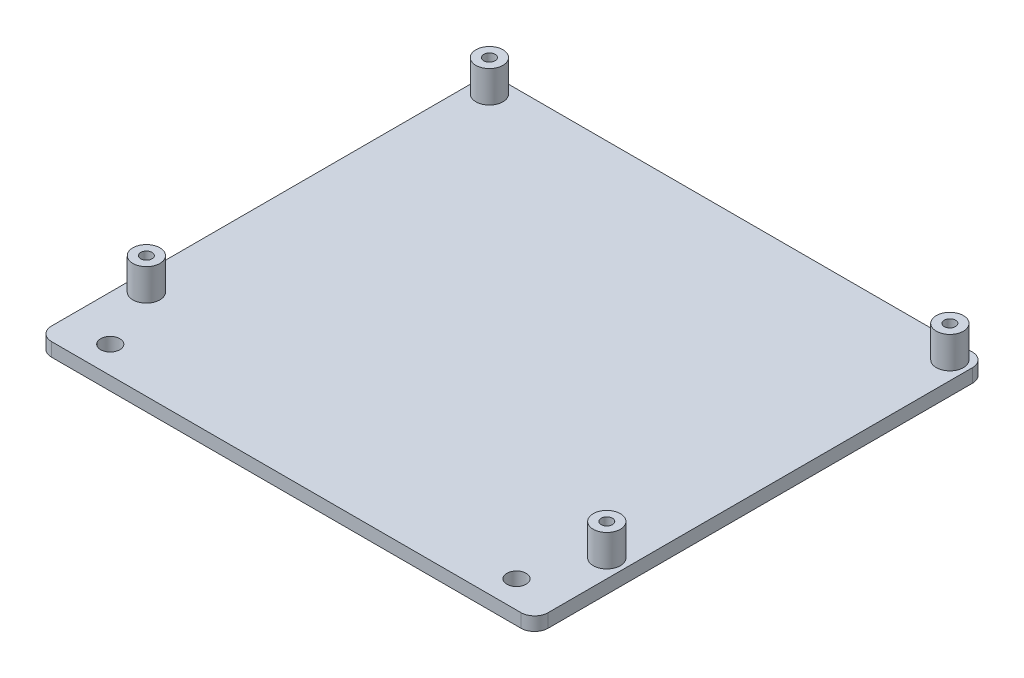
from build123d import *

# Parameters (mm, degrees)
SKETCH1_R           = 1.25
BOSS_EXTRUDE1_DEPTH = 3
FILLET1_R           = 3
SKETCH2_R           = 3
SKETCH2_R_2         = 1.25
BOSS_EXTRUDE2_DEPTH = 7
SKETCH4_R           = 2.125
CUT_EXTRUDE1_DEPTH  = 149.996644258


with BuildPart() as part:
    # Sketch1 → Boss-Extrude1 (new body)
    with BuildSketch(Plane(origin=(0, 0, 0), x_dir=(1, 0, 0), z_dir=(0, 1, 0))):
        Polygon((0, 0), (110, 0), (110, 16), (110, 100), (0, 100), (0, 16), align=None)
        with Locations((4, 96)):
            Circle(SKETCH1_R, mode=Mode.SUBTRACT)
        with Locations((106, 96)):
            Circle(SKETCH1_R, mode=Mode.SUBTRACT)
        with Locations((106, 20)):
            Circle(SKETCH1_R, mode=Mode.SUBTRACT)
        with Locations((4, 20)):
            Circle(SKETCH1_R, mode=Mode.SUBTRACT)
    extrude(amount=BOSS_EXTRUDE1_DEPTH)

    # Fillet1
    fillet1_edges = [part.edges().sort_by_distance(p)[0] for p in [
        (0, 1.5, -100),
        (110, 1.5, -100),
        (0, 1.5, 0),
        (110, 1.5, 0),
    ]]
    fillet(fillet1_edges, radius=FILLET1_R)

    # Sketch2 → Boss-Extrude2 (add)
    # profile 1 of 4: a face of its own
    with BuildSketch(Plane(origin=(0, 3, 0), x_dir=(1, 0, 0), z_dir=(0, 1, 0))):
        with Locations((4, 96)):
            Circle(SKETCH2_R)
        with Locations((4, 96)):
            Circle(SKETCH2_R_2, mode=Mode.SUBTRACT)
    # profile 2 of 4: a face of its own
    with BuildSketch(Plane(origin=(0, 3, 0), x_dir=(1, 0, 0), z_dir=(0, 1, 0))):
        with Locations((106, 96)):
            Circle(SKETCH2_R)
        with Locations((106, 96)):
            Circle(SKETCH2_R_2, mode=Mode.SUBTRACT)
    # profile 3 of 4: a face of its own
    with BuildSketch(Plane(origin=(0, 3, 0), x_dir=(1, 0, 0), z_dir=(0, 1, 0))):
        with Locations((106, 20)):
            Circle(SKETCH2_R)
        with Locations((106, 20)):
            Circle(SKETCH2_R_2, mode=Mode.SUBTRACT)
    # profile 4 of 4: a face of its own
    with BuildSketch(Plane(origin=(0, 3, 0), x_dir=(1, 0, 0), z_dir=(0, 1, 0))):
        with Locations((4, 20)):
            Circle(SKETCH2_R)
        with Locations((4, 20)):
            Circle(SKETCH2_R_2, mode=Mode.SUBTRACT)
    extrude(amount=BOSS_EXTRUDE2_DEPTH)

    # Sketch4 → Cut-Extrude1 (cut, through all)
    with BuildSketch(Plane.XZ):
        with Locations((10, -6)):
            Circle(SKETCH4_R)
        with Locations((100, -6)):
            Circle(SKETCH4_R)
    extrude(amount=-CUT_EXTRUDE1_DEPTH, mode=Mode.SUBTRACT)


solid = part.part
